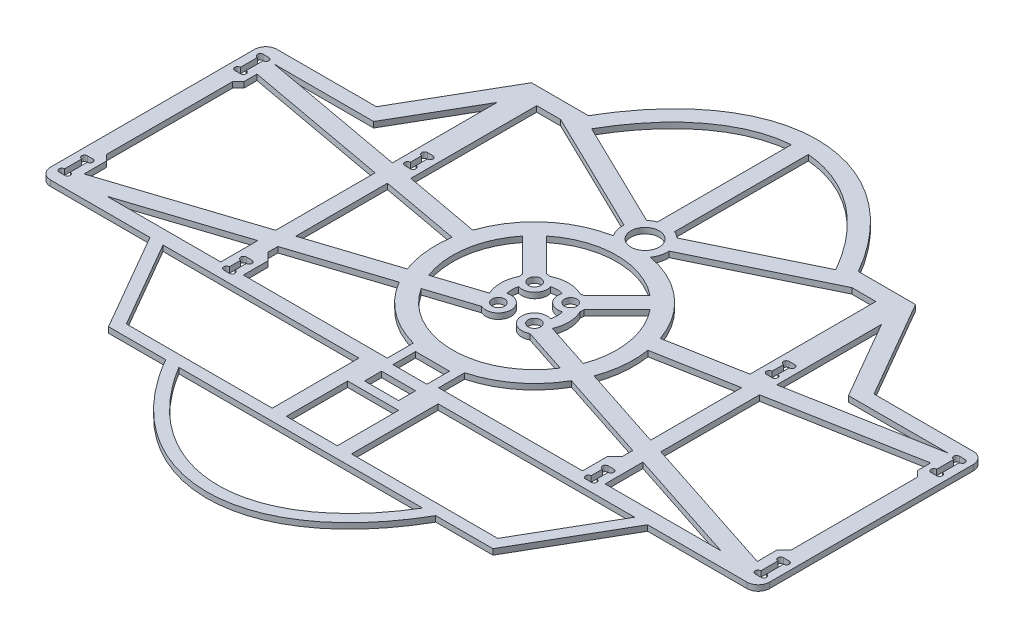
from build123d import *

# Parameters (mm, degrees)
SKETCH_1_W          = 9
SKETCH_1_H          = 10.82050806
SKETCH_1_W_2        = 6
SKETCH_1_H_2        = 3
SKETCH_1_H_3        = 4
SKETCH_1_R          = 14.5
SKETCH_1_R_2        = 2.5
SKETCH_1_R_3        = 1.100000002
SKETCH_1_R_4        = 1.100000003
SKETCH_1_R_5        = 1.1
SKETCH_1_R_6        = 1.100000005
EXTRUDE_1_DEPTH     = 1
CUT_EXTRUDE_1_DEPTH = 10
EXTRUDE_2_DEPTH     = 1
FILLET_2_R          = 2


# Read off the part's stored shape, not the designer's step: 凸台-拉伸2
with BuildPart() as part:
    # 草图1 → 凸台-拉伸1 (new body)
    # profile 1 of 3: a face of its own
    with BuildSketch(Plane(origin=(0, 0, 0), x_dir=(1, 0, 0), z_dir=(0, 1, 0))):
        with BuildLine():
            Line((-25.993047701, 36.879947598), (-27.454826651, 36.879947598))
            Line((-27.454826651, 36.879947598), (-40.031460704, 36.879947598))
            Line((-40.031460704, 36.879947598), (-45.035389758, 36.879947598))
            Line((-45.035389758, 36.879947598), (-45.535389758, 36.879947598))
            Line((-45.535389758, 36.879947598), (-45.535389758, -3.120052709))
            Line((-45.535389758, -3.120052709), (-45.035389758, -3.120052709))
            Line((-45.035389758, -3.120052709), (-40.031460704, -3.120052709))
            Line((-40.031460704, -3.120052709), (-25.992952503, -3.120052709))
            Line((-25.992952503, -3.120052709), (-15.9929525, -20.440560791))
            Line((-15.9929525, -20.440560791), (-5.888773755, -20.440560791))
            add(Edge.make_bspline(
                [(41.817994367, -20.440560791), (41.503647787, -20.990472424), (38.351122385, -26.26297316), (32.691381395, -32.34610436), (24.475295424, -36.342803758), (17.964610144, -37.372857118), (11.453924875, -36.342803689), (3.237838946, -32.346104204), (-2.421901918, -26.262973009), (-5.574427226, -20.99047234), (-5.888773755, -20.440560791)],
                knots=[5.453046194, 5.453046194, 5.453046194, 5.453046194, 5.497787144, 5.890486225, 6.086835766, 6.283185307, 6.479534848, 6.675884389, 7.068583471, 7.113324414, 7.113324414, 7.113324414, 7.113324414], degree=3))
            Line((41.817994367, -20.440560791), (51.926248956, -20.440560791))
            Line((51.926248956, -20.440560791), (61.92624896, -3.120052709))
            Line((61.92624896, -3.120052709), (75.968539296, -3.120052709))
            Line((75.968539296, -3.120052709), (80.968604338, -3.120052709))
            Line((80.968604338, -3.120052709), (81.472533407, -3.120052709))
            Line((81.472533407, -3.120052709), (81.472533407, 36.879974623))
            Line((81.472533407, 36.879974623), (80.968604338, 36.879974623))
            Line((80.968604338, 36.879974623), (75.968582549, 36.879974623))
            Line((75.968582549, 36.879974623), (61.926197014, 36.879974623))
            Line((61.926197014, 36.879974623), (51.926197012, 54.200482704))
            Line((51.926197012, 54.200482704), (51.901212615, 54.243756948))
            Line((51.901212615, 54.243756948), (41.797372882, 54.243756948))
            add(Edge.make_bspline(
                [(41.797372882, 54.243756948), (41.490853456, 54.778713279), (38.344546711, 60.034622062), (32.694864745, 66.107013092), (24.478103554, 70.104100484), (17.966870686, 71.134279582), (11.455625758, 70.104176714), (3.238817772, 66.10718552), (-2.411002924, 60.034787938), (-5.557412805, 54.778806205), (-5.863989116, 54.243756948)],
                knots=[5.454222433, 5.454222433, 5.454222433, 5.454222433, 5.497787144, 5.890486225, 6.086835766, 6.283185307, 6.479534848, 6.675884389, 7.068583471, 7.112155755, 7.112155755, 7.112155755, 7.112155755], degree=3))
            Line((-5.863989116, 54.243756948), (-15.968047698, 54.243756948))
            Line((-15.968047698, 54.243756948), (-15.993047698, 54.200455678))
            Line((-15.993047698, 54.200455678), (-25.993047701, 36.879947598))
        make_face()
        with BuildLine():
            add(Edge.make_bspline(
                [(-3.564657788, -20.440560791), (17.968539296, -56.006022728), (39.50173638, -20.440560791)],
                knots=[5.481489759, 5.481489759, 5.481489759, 7.084880855, 7.084880855, 7.084880855], degree=2, weights=[1, 0.695489397, 1]))
            Line((-3.564657788, -20.440560791), (39.50173638, -20.440560791))
        make_face(mode=Mode.SUBTRACT)
        with BuildLine():
            Line((-44.031569224, -0.154035372), (-44.031569224, 2.845964628))
            ThreePointArc((-44.031569224, 2.845964628), (-44.531569224, 3.345964628), (-44.031569224, 3.845964628))
            Line((-44.031569224, 3.845964628), (-43.031352169, 3.845964628))
            ThreePointArc((-43.031352169, 3.845964628), (-42.531352169, 3.345964628), (-43.031352169, 2.845964628))
            Line((-43.031352169, 2.845964628), (-43.031352169, -0.154035372))
            ThreePointArc((-43.031352169, -0.154035372), (-42.531352169, -0.654035372), (-43.031352169, -1.154035372))
            Line((-43.031352169, -1.154035372), (-44.031569224, -1.154035372))
            ThreePointArc((-44.031569224, -1.154035372), (-44.531569224, -0.654035372), (-44.031569224, -0.154035372))
        make_face(mode=Mode.SUBTRACT)
        with BuildLine():
            ThreePointArc((-14.48788449, 1.402047638), (-14.98788449, 1.902047638), (-14.48788449, 2.402047638))
            Line((-14.48788449, 2.402047638), (-13.48788449, 2.402047638))
            ThreePointArc((-13.48788449, 2.402047638), (-12.98788449, 1.902047638), (-13.48788449, 1.402047638))
            Line((-13.48788449, 1.402047638), (-13.48788449, -0.597952362))
            ThreePointArc((-13.48788449, -0.597952362), (-12.98788449, -1.097952362), (-13.48788449, -1.597952362))
            Line((-13.48788449, -1.597952362), (-14.48788449, -1.597952362))
            ThreePointArc((-14.48788449, -1.597952362), (-14.98788449, -1.097952362), (-14.48788449, -0.597952362))
            Line((-14.48788449, -0.597952362), (-14.48788449, 1.402047638))
        make_face(mode=Mode.SUBTRACT)
        Polygon((-14.834418105, -18.440616857), (-23.679717571, -3.120108775), (10.930082816, -3.120108775), (10.930082816, -18.440616857), align=None, mode=Mode.SUBTRACT)
        with Locations((17.930082816, -13.030362827)):
            Rectangle(SKETCH_1_W, SKETCH_1_H, mode=Mode.SUBTRACT)
        with Locations((17.930082815, -4.620108775)):
            Rectangle(SKETCH_1_W_2, SKETCH_1_H_2, mode=Mode.SUBTRACT)
        with Locations((17.930082815, 0.879891225)):
            Rectangle(SKETCH_1_W_2, SKETCH_1_H_3, mode=Mode.SUBTRACT)
        Polygon((24.930082816, -18.440616857), (24.930082816, -3.120108775), (59.620681739, -3.120108775), (50.775382274, -18.440616857), align=None, mode=Mode.SUBTRACT)
        with BuildLine():
            ThreePointArc((49.428848658, 1.402047638), (48.928848658, 1.902047638), (49.428848658, 2.402047638))
            Line((49.428848658, 2.402047638), (50.428848658, 2.402047638))
            ThreePointArc((50.428848658, 2.402047638), (50.928848658, 1.902047638), (50.428848658, 1.402047638))
            Line((50.428848658, 1.402047638), (50.428848658, -0.597952362))
            ThreePointArc((50.428848658, -0.597952362), (50.928848658, -1.097952362), (50.428848658, -1.597952362))
            Line((50.428848658, -1.597952362), (49.428848658, -1.597952362))
            ThreePointArc((49.428848658, -1.597952362), (48.928848658, -1.097952362), (49.428848658, -0.597952362))
            Line((49.428848658, -0.597952362), (49.428848658, 1.402047638))
        make_face(mode=Mode.SUBTRACT)
        with BuildLine():
            Line((78.972316353, -0.154035372), (78.972316353, 2.845964628))
            ThreePointArc((78.972316353, 2.845964628), (78.472316353, 3.345964628), (78.972316353, 3.845964628))
            Line((78.972316353, 3.845964628), (79.972533407, 3.845964628))
            ThreePointArc((79.972533407, 3.845964628), (80.472533407, 3.345964628), (79.972533407, 2.845964628))
            Line((79.972533407, 2.845964628), (79.972533407, -0.154035372))
            ThreePointArc((79.972533407, -0.154035372), (80.472533407, -0.654035372), (79.972533407, -1.154035372))
            Line((79.972533407, -1.154035372), (78.972316353, -1.154035372))
            ThreePointArc((78.972316353, -1.154035372), (78.472316353, -0.654035372), (78.972316353, -0.154035372))
        make_face(mode=Mode.SUBTRACT)
        with BuildLine():
            Line((-43.740530226, 34.913876852), (-43.322174128, 34.913876852))
            Line((-43.322174128, 34.913876852), (-43.03124365, 34.913876852))
            ThreePointArc((-43.03124365, 34.913876852), (-42.53124365, 34.413876852), (-43.03124365, 33.913876852))
            Line((-43.03124365, 33.913876852), (-43.03124365, 30.913876852))
            ThreePointArc((-43.03124365, 30.913876852), (-42.53124365, 30.413876852), (-43.03124365, 29.913876852))
            Line((-43.03124365, 29.913876852), (-43.322174128, 29.913876852))
            Line((-43.322174128, 29.913876852), (-43.740530226, 29.913876852))
            Line((-43.740530226, 29.913876852), (-44.031460704, 29.913876852))
            ThreePointArc((-44.031460704, 29.913876852), (-44.531460704, 30.413876852), (-44.031460704, 30.913876852))
            Line((-44.031460704, 30.913876852), (-44.031460704, 33.913876852))
            ThreePointArc((-44.031460704, 33.913876852), (-44.531460704, 34.413876852), (-44.031460704, 34.913876852))
            Line((-44.031460704, 34.913876852), (-43.740530226, 34.913876852))
        make_face(mode=Mode.SUBTRACT)
        with BuildLine():
            ThreePointArc((-14.48788449, 33.377523288), (-14.98788449, 33.877523288), (-14.48788449, 34.377523288))
            Line((-14.48788449, 34.377523288), (-13.48788449, 34.377523288))
            ThreePointArc((-13.48788449, 34.377523288), (-12.98788449, 33.877523288), (-13.48788449, 33.377523288))
            Line((-13.48788449, 33.377523288), (-13.48788449, 31.377523288))
            ThreePointArc((-13.48788449, 31.377523288), (-12.98788449, 30.877523288), (-13.48788449, 30.377523288))
            Line((-13.48788449, 30.377523288), (-14.48788449, 30.377523288))
            ThreePointArc((-14.48788449, 30.377523288), (-14.98788449, 30.877523288), (-14.48788449, 31.377523288))
            Line((-14.48788449, 31.377523288), (-14.48788449, 33.377523288))
        make_face(mode=Mode.SUBTRACT)
        with Locations(Location((17.968539296, 20.879919411, 0), (0, 0, 270))):
            Circle(SKETCH_1_R, mode=Mode.SUBTRACT)
        with BuildLine():
            Line((38.300937433, 54.243756961), (-2.367601951, 54.243756948))
            add(Edge.make_bspline(
                [(38.300937433, 54.243756961), (38.247543447, 54.329050339), (37.8333691, 54.985558769), (36.672087923, 56.717663454), (34.696342944, 59.236301388), (32.15657943, 61.837388088), (28.585898588, 64.712932662), (23.847816761, 67.140747835), (17.966745299, 68.115975542), (12.085665131, 67.140745521), (7.347564605, 64.712927437), (3.77686199, 61.837379995), (1.237079337, 59.236291476), (-0.713596778, 56.749632212), (-1.878449822, 55.017524922), (-2.291499255, 54.365283455), (-2.367601951, 54.243756948)],
                knots=[5.498333983, 5.498333983, 5.498333983, 5.498333983, 5.50603285, 5.557843266, 5.661464098, 5.765084931, 5.868705764, 6.075947429, 6.283189094, 6.490430759, 6.697672424, 6.801293257, 6.904914089, 7.008534922, 7.057056061, 7.068075999, 7.068075999, 7.068075999, 7.068075999], degree=3))
        make_face(mode=Mode.SUBTRACT)
        with BuildLine():
            ThreePointArc((49.428848658, 33.377523288), (48.928848658, 33.877523288), (49.428848658, 34.377523288))
            Line((49.428848658, 34.377523288), (50.428848658, 34.377523288))
            ThreePointArc((50.428848658, 34.377523288), (50.928848658, 33.877523288), (50.428848658, 33.377523288))
            Line((50.428848658, 33.377523288), (50.428848658, 31.377523288))
            ThreePointArc((50.428848658, 31.377523288), (50.928848658, 30.877523288), (50.428848658, 30.377523288))
            Line((50.428848658, 30.377523288), (49.428848658, 30.377523288))
            ThreePointArc((49.428848658, 30.377523288), (48.928848658, 30.877523288), (49.428848658, 31.377523288))
            Line((49.428848658, 31.377523288), (49.428848658, 33.377523288))
        make_face(mode=Mode.SUBTRACT)
        with BuildLine():
            Line((78.972316337, 30.913876852), (78.972316337, 33.913876852))
            ThreePointArc((78.972316337, 33.913876852), (78.472316337, 34.413876852), (78.972316337, 34.913876852))
            Line((78.972316337, 34.913876852), (79.972533392, 34.913876852))
            ThreePointArc((79.972533392, 34.913876852), (80.472533392, 34.413876852), (79.972533392, 33.913876852))
            Line((79.972533392, 33.913876852), (79.972533392, 30.913876852))
            ThreePointArc((79.972533392, 30.913876852), (80.472533392, 30.413876852), (79.972533392, 29.913876852))
            Line((79.972533392, 29.913876852), (78.972316337, 29.913876852))
            ThreePointArc((78.972316337, 29.913876852), (78.472316337, 30.413876852), (78.972316337, 30.913876852))
        make_face(mode=Mode.SUBTRACT)
        with Locations(Location((17.970482084, 40.380554177, 0), (0, 0, 270))):
            Circle(SKETCH_1_R_2, mode=Mode.SUBTRACT)
    # profile 2 of 3: a face of its own
    with BuildSketch(Plane(origin=(0, 0, 0), x_dir=(1, 0, 0), z_dir=(0, 1, 0))):
        with BuildLine():
            add(Edge.make_bspline(
                [(38.300937433, 54.243756961), (38.247543447, 54.329050339), (37.8333691, 54.985558769), (36.672087923, 56.717663454), (34.696342944, 59.236301388), (32.15657943, 61.837388088), (28.585898588, 64.712932662), (23.847816761, 67.140747835), (17.966745299, 68.115975542), (12.085665131, 67.140745521), (7.347564605, 64.712927437), (3.77686199, 61.837379995), (1.237079337, 59.236291476), (-0.713596778, 56.749632212), (-1.878449822, 55.017524922), (-2.291499255, 54.365283455), (-2.367601951, 54.243756948)],
                knots=[5.498333983, 5.498333983, 5.498333983, 5.498333983, 5.50603285, 5.557843266, 5.661464098, 5.765084931, 5.868705764, 6.075947429, 6.283189094, 6.490430759, 6.697672424, 6.801293257, 6.904914089, 7.008534922, 7.057056061, 7.068075999, 7.068075999, 7.068075999, 7.068075999], degree=3))
            Line((-2.367601951, 54.243756948), (38.300937433, 54.243756961))
        make_face()
    # profile 3 of 3: a face of its own
    with BuildSketch(Plane(origin=(0, 0, 0), x_dir=(1, 0, 0), z_dir=(0, 1, 0))):
        with BuildLine():
            ThreePointArc((14.1025182, 19.853332405), (13.968543319, 20.885592668), (14.105445796, 21.917468741))
            ThreePointArc((14.105445796, 21.917468741), (16.377549042, 22.470909666), (16.930989967, 24.743012911))
            ThreePointArc((16.930989967, 24.743012911), (17.968539296, 24.879919411), (19.006088625, 24.743012911))
            ThreePointArc((19.006088625, 24.743012911), (19.559529551, 22.470909666), (21.831632796, 21.917468741))
            ThreePointArc((21.831632796, 21.917468741), (21.968534826, 20.873939443), (21.828513275, 19.830824144))
            ThreePointArc((21.828513275, 19.830824144), (19.429410755, 16.2042253), (23.314840968, 18.156491711))
            ThreePointArc((23.314840968, 18.156491711), (23.968465633, 20.850188173), (23.341568382, 23.550229963))
            ThreePointArc((23.341568382, 23.550229963), (22.741510066, 25.652890181), (20.638849848, 26.252948497))
            ThreePointArc((20.638849848, 26.252948497), (17.968539296, 26.879919411), (15.298228744, 26.252948497))
            ThreePointArc((15.298228744, 26.252948497), (13.195568526, 25.652890181), (12.59551021, 23.550229963))
            ThreePointArc((12.59551021, 23.550229963), (11.968609671, 20.908979586), (12.569896033, 18.261780584))
            ThreePointArc((12.569896033, 18.261780584), (16.368814281, 16.137236274), (14.1025182, 19.853332405))
        make_face()
        with Locations(Location((14.748102303, 17.697938899, 0), (0, 0, 270))):
            Circle(SKETCH_1_R_3, mode=Mode.SUBTRACT)
        with Locations(Location((14.786558784, 24.061899923, 0), (0, 0, 270))):
            Circle(SKETCH_1_R_4, mode=Mode.SUBTRACT)
        with Locations(Location((21.112063331, 17.697938897, 0), (0, 0, 270))):
            Circle(SKETCH_1_R_5, mode=Mode.SUBTRACT)
        with Locations(Location((21.150519808, 24.061899923, 0), (0, 0, 270))):
            Circle(SKETCH_1_R_6, mode=Mode.SUBTRACT)
    extrude(amount=EXTRUDE_1_DEPTH)

    # 草图3 → 切除-拉伸1 (cut)
    with BuildSketch(Plane(origin=(0, 1, 0), x_dir=(1, 0, 0), z_dir=(0, 1, 0))):
        Polygon((51.928848658, 26.650505261), (51.928848658, 9.212868768), (77.222316353, 0.953453884), (77.222316353, 4.472165911), (78.472533392, 5.722382951), (78.472533392, 28.037458544), (77.472316337, 29.037675598), (77.472316337, 31.330020716), align=None)
        with BuildLine():
            Line((49.252071963, 10.086952526), (49.252071963, 26.160124782))
            Line((49.252071963, 26.160124782), (35.258120969, 23.596459161))
            ThreePointArc((35.258120969, 23.596459161), (35.390729406, 19.209628985), (34.427676016, 14.92776115))
            Line((34.427676016, 14.92776115), (49.252071963, 10.086952526))
        make_face()
        Polygon((51.928848658, 29.700432143), (77.472316337, 34.379947598), (59.908122719, 34.379947598), (51.928848658, 48.200455678), align=None)
        Polygon((72.390040845, -0.62449378), (51.928848658, 6.056973441), (51.928848658, -0.62449378), align=None)
        with BuildLine():
            Line((34.538079372, 26.51447577), (47.976457139, 28.976361417))
            Line((47.976457139, 28.976361417), (47.928848658, 29.023969898))
            Line((47.928848658, 29.023969898), (47.928848658, 51.200455678))
            Line((47.928848658, 51.200455678), (43.692119035, 51.200455678))
            Line((43.692119035, 51.200455678), (21.961354947, 40.650616755))
            ThreePointArc((21.961354947, 40.650616755), (21.821291017, 39.298301635), (21.236368621, 38.071011986))
            ThreePointArc((21.236368621, 38.071011986), (29.447857764, 34.089051922), (34.538079372, 26.51447577))
        make_face()
        with BuildLine():
            Line((49.252071963, 5.078824333), (49.252071963, 6.931057199))
            Line((49.252071963, 6.931057199), (33.159072962, 12.186119774))
            ThreePointArc((33.159072962, 12.186119774), (28.654709138, 7.018539142), (22.510881353, 3.977722933))
            Line((22.510881353, 3.977722933), (22.510881353, -0.62449378))
            Line((22.510881353, -0.62449378), (47.928848658, -0.62449378))
            Line((47.928848658, -0.62449378), (47.928848658, 3.755601028))
            Line((47.928848658, 3.755601028), (49.252071963, 5.078824333))
        make_face()
        with BuildLine():
            Line((13.430082815, -0.62449378), (13.430082815, 3.977722933))
            ThreePointArc((13.430082815, 3.977722933), (7.345324807, 6.973203902), (2.856411169, 12.057182718))
            Line((2.856411169, 12.057182718), (-13.311107795, 6.793658389))
            Line((-13.311107795, 6.793658389), (-13.311107795, 5.078824333))
            Line((-13.311107795, 5.078824333), (-11.98788449, 3.755601028))
            Line((-11.98788449, 3.755601028), (-11.98788449, -0.62449378))
            Line((-11.98788449, -0.62449378), (13.430082815, -0.62449378))
        make_face()
        with BuildLine():
            Line((-13.311107795, 9.948640728), (1.563315783, 14.791182775))
            ThreePointArc((1.563315783, 14.791182775), (0.557346696, 19.136986406), (0.682761355, 23.595938544))
            Line((0.682761355, 23.595938544), (-13.311107795, 26.159770988))
            Line((-13.311107795, 26.159770988), (-13.311107795, 9.948640728))
        make_face()
        with BuildLine():
            ThreePointArc((1.402712541, 26.513969387), (6.492904518, 34.08887652), (14.704595548, 38.071011986))
            ThreePointArc((14.704595548, 38.071011986), (14.119937627, 39.297361034), (13.979477762, 40.64866703))
            Line((13.979477762, 40.64866703), (-7.755302407, 51.200455678))
            Line((-7.755302407, 51.200455678), (-11.98788449, 51.200455678))
            Line((-11.98788449, 51.200455678), (-11.98788449, 29.023969898))
            Line((-11.98788449, 29.023969898), (-12.035800054, 28.976054334))
            Line((-12.035800054, 28.976054334), (1.402712541, 26.513969387))
        make_face()
        with BuildLine():
            ThreePointArc((19.470482084, 44.08865342), (20.093248188, 43.770814354), (20.651155921, 43.349390275))
            Line((20.651155921, 43.349390275), (39.536025924, 52.517606165))
            add(Edge.make_bspline(
                [(39.536025924, 52.517606165), (31.447581191, 66.738371746), (19.470482084, 67.727502766)],
                knots=[5.45737182, 5.45737182, 5.45737182, 6.235063971, 6.235063971, 6.235063971], degree=2, weights=[0.983230691, 0.832504322, 0.82372128]))
            Line((19.470482084, 67.727502766), (19.470482084, 44.08865342))
        make_face()
        with BuildLine():
            ThreePointArc((15.288358465, 43.348080569), (15.846888072, 43.770295829), (16.470482084, 44.08865342))
            Line((16.470482084, 44.08865342), (16.470482084, 67.727502766))
            add(Edge.make_bspline(
                [(16.470482084, 67.727502766), (4.492606503, 66.738307621), (-3.59595917, 52.516028296)],
                knots=[6.331306643, 6.331306643, 6.331306643, 7.10904975, 7.10904975, 7.10904975], degree=2, weights=[0.82372128, 0.832504897, 0.983250443]))
            Line((-3.59595917, 52.516028296), (15.288358465, 43.348080569))
        make_face()
        Polygon((-41.53124365, 34.379947598), (-15.98788449, 29.700120151), (-15.98788449, 48.202593296), (-23.968392705, 34.379947598), align=None)
        Polygon((-15.98788449, 9.077184861), (-15.98788449, 26.650186245), (-41.53124365, 31.330013692), (-41.53124365, 29.037784103), (-42.531460704, 28.037567049), (-42.531460704, 5.722274431), (-41.531352169, 4.722165896), (-41.531352169, 0.761211095), align=None)
        Polygon((-15.98788449, -0.62449378), (-15.98788449, 5.922202522), (-36.096813416, -0.62449378), align=None)
    extrude(amount=-CUT_EXTRUDE_1_DEPTH, mode=Mode.SUBTRACT)

    # 凸台-拉伸2 outline → 凸台-拉伸2 (add)
    with BuildSketch(Plane(origin=(0, 0, 0), x_dir=(1, 0, 0), z_dir=(0, 1, 0))):
        with BuildLine():
            ThreePointArc((12.540044489, 24.187093874), (13.195568526, 25.652890181), (14.661364833, 26.308414218))
            Line((14.661364833, 26.308414218), (8.831160441, 32.13861861))
            ThreePointArc((8.831160441, 32.13861861), (7.715490969, 31.132967738), (6.709840097, 30.017298267))
            Line((6.709840097, 30.017298267), (12.540044489, 24.187093874))
        make_face()
        with BuildLine():
            ThreePointArc((29.227238495, 30.017298267), (28.221587623, 31.132967738), (27.105918151, 32.13861861))
            Line((27.105918151, 32.13861861), (21.275713759, 26.308414218))
            ThreePointArc((21.275713759, 26.308414218), (22.741510066, 25.652890181), (23.397034103, 24.187093874))
            Line((23.397034103, 24.187093874), (29.227238495, 30.017298267))
        make_face()
        with BuildLine():
            Line((12.523617973, 18.359436961), (4.417544339, 15.720410164))
            ThreePointArc((4.417544339, 15.720410164), (5.032132416, 14.33015781), (5.788883766, 13.011883368))
            Line((5.788883766, 13.011883368), (13.848264906, 15.635708878))
            ThreePointArc((13.848264906, 15.635708878), (12.725072062, 16.713129961), (12.569896033, 18.261780584))
            ThreePointArc((12.569896033, 18.261780584), (12.546537136, 18.31050458), (12.523617973, 18.359436961))
        make_face()
        with BuildLine():
            ThreePointArc((30.231362613, 13.142144259), (30.972875428, 14.466087345), (31.571964225, 15.860274981))
            Line((31.571964225, 15.860274981), (23.477805054, 18.50336922))
            ThreePointArc((23.477805054, 18.50336922), (23.399093325, 18.328628964), (23.314840968, 18.156491711))
            ThreePointArc((23.314840968, 18.156491711), (23.166460337, 16.780358958), (22.240651985, 15.751458059))
            Line((22.240651985, 15.751458059), (30.231362613, 13.142144259))
        make_face()
    extrude(amount=EXTRUDE_2_DEPTH)

    # 圆角2
    fillet_2_edges = [part.edges().sort_by_distance(p)[0] for p in [
        (81.472533407, 0.5, 3.120052709),
        (81.472533407, 0.5, -36.879974623),
        (-45.535389758, 0.5, -36.879947598),
        (-45.535389758, 0.5, 3.120052709),
    ]]
    fillet(fillet_2_edges, radius=FILLET_2_R)


solid = part.part
